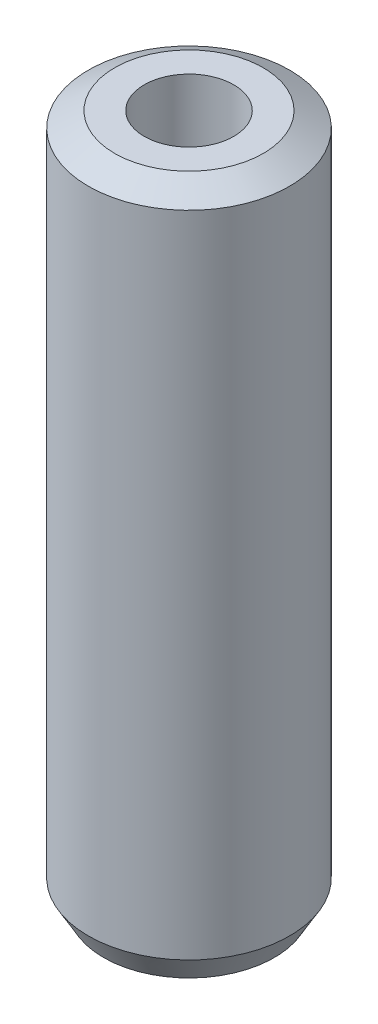
from build123d import *
from OCP.BRepFilletAPI import BRepFilletAPI_MakeChamfer

# Parameters (mm, degrees)
SKETCH1_R           = 10
BOSS_EXTRUDE1_DEPTH = 68.63727892
SKETCH2_R           = 4.447035577
CUT_EXTRUDE1_DEPTH  = 71.079070039
CHAMFER1_SIZE       = 1.511466998
CHAMFER1_SIZE2      = 2.617937634


with BuildPart() as part:
    # Sketch1 → Boss-Extrude1 (new body)
    with BuildSketch(Plane(origin=(0, 0, 0), x_dir=(1, 0, 0), z_dir=(0, 1, 0))):
        Circle(SKETCH1_R)
    extrude(amount=BOSS_EXTRUDE1_DEPTH)

    # Sketch2 → Cut-Extrude1 (cut, through all)
    with BuildSketch(Plane(origin=(0, 0, 0), x_dir=(1, 0, 0), z_dir=(0, 1, 0))):
        Circle(SKETCH2_R)
    extrude(amount=CUT_EXTRUDE1_DEPTH, mode=Mode.SUBTRACT)

    # Chamfer1: one chamfer whose edges measure the first distance from different faces: ONE call of the kernel's chamfer builder (chamfer() names one face for all edges)
    chamfer1_edges_1 = [part.edges().sort_by_distance(p)[0] for p in [
        (-10, 68.63727892, 0),
    ]]
    chamfer1_side_1 = [part.faces().sort_by_distance(p)[0] for p in [
        (-10, 34.31863946, 0),
    ]]
    chamfer1_edges_2 = [part.edges().sort_by_distance(p)[0] for p in [
        (-10, 0, 0),
    ]]
    chamfer1_side_2 = [part.faces().sort_by_distance(p)[0] for p in [
        (-9.717157288, 0, 0),
    ]]
    chamfer1 = BRepFilletAPI_MakeChamfer(part.part.solid().wrapped)
    for e in chamfer1_edges_1:
        chamfer1.Add(CHAMFER1_SIZE, CHAMFER1_SIZE2, e.wrapped, chamfer1_side_1[0].wrapped)  # the first distance lies on this face
    for e in chamfer1_edges_2:
        chamfer1.Add(CHAMFER1_SIZE, CHAMFER1_SIZE2, e.wrapped, chamfer1_side_2[0].wrapped)  # the first distance lies on this face
    add(Compound.cast(chamfer1.Shape()), mode=Mode.REPLACE)


solid = part.part
